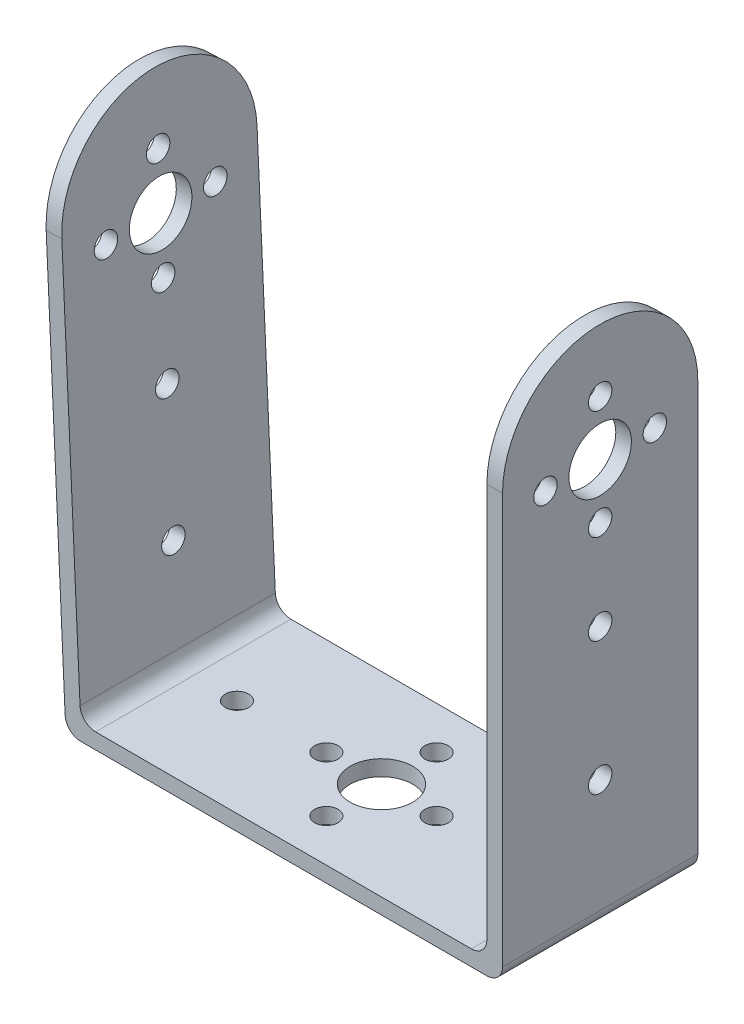
from build123d import *

# Parameters (mm, degrees)
BOSS_EXTRUDE1_DEPTH = 25
SKETCH4_R           = 4
SKETCH4_R_2         = 1.5
CUT_EXTRUDE3_DEPTH  = 2
SKETCH5_R           = 4
SKETCH5_R_2         = 1.5
CUT_EXTRUDE4_DEPTH  = 2
SKETCH6_R           = 4
SKETCH6_R_2         = 1.5
CUT_EXTRUDE5_DEPTH  = 2
FILLET2_R           = 2


with BuildPart() as part:
    # Sketch1 → Boss-Extrude1 (new body)
    with BuildSketch(Plane.XY):
        Polygon((27.999082786, 67), (25.999082786, 67), (25.999082786, 2), (-26.000917214, 2), (-29.000917214, 67), (-30.998790434, 66.907790467), (-27.910738566, 0), (-26.000917214, 0), (27.999082786, 0), align=None)
    extrude(amount=-BOSS_EXTRUDE1_DEPTH)

    # Sketch4 → Cut-Extrude3 (cut)
    with BuildSketch(Plane(origin=(-27.851410119, -1.285449698, 0), x_dir=(0, 0, 1), z_dir=(-0.9989366098486853, -0.046104766608406705, 0))):
        with BuildLine():
            Line((0, 68.265833379), (-12.5, 68.265833379))
            ThreePointArc((-12.5, 68.265833379), (-3.661165235, 64.604668144), (0, 55.765833379))
            Line((0, 55.765833379), (0, 68.265833379))
        make_face()
        with BuildLine():
            Line((-25, 68.265833379), (-25, 55.765833379))
            ThreePointArc((-25, 55.765833379), (-21.338834765, 64.604668144), (-12.5, 68.265833379))
            Line((-12.5, 68.265833379), (-25, 68.265833379))
        make_face()
        with Locations((-12.5, 52.430262694)):
            Circle(SKETCH4_R)
        with Locations((-19.5, 52.430262694)):
            Circle(SKETCH4_R_2)
        with Locations((-12.5, 59.430262694)):
            Circle(SKETCH4_R_2)
        with Locations((-5.5, 52.430262694)):
            Circle(SKETCH4_R_2)
        with Locations((-12.5, 45.430262694)):
            Circle(SKETCH4_R_2)
        with Locations((-12.5, 33.930262694)):
            Circle(SKETCH4_R_2)
        with Locations((-12.5, 16.930262694)):
            Circle(SKETCH4_R_2)
    extrude(amount=-CUT_EXTRUDE3_DEPTH, mode=Mode.SUBTRACT)

    # Sketch5 → Cut-Extrude4 (cut)
    with BuildSketch(Plane(origin=(27.999082786, 0, 0), x_dir=(0, 0, -1), z_dir=(1, 0, 0))):
        with BuildLine():
            Line((25, 67), (12.5, 67))
            ThreePointArc((12.5, 67), (21.338834765, 63.338834765), (25, 54.5))
            Line((25, 54.5), (25, 67))
        make_face()
        with BuildLine():
            Line((0, 67), (0, 54.5))
            ThreePointArc((0, 54.5), (3.661165235, 63.338834765), (12.5, 67))
            Line((12.5, 67), (0, 67))
        make_face()
        with Locations((12.5, 52)):
            Circle(SKETCH5_R)
        with Locations((5.5, 52)):
            Circle(SKETCH5_R_2)
        with Locations((12.5, 59)):
            Circle(SKETCH5_R_2)
        with Locations((19.5, 52)):
            Circle(SKETCH5_R_2)
        with Locations((12.5, 45)):
            Circle(SKETCH5_R_2)
        with Locations((12.5, 33.5)):
            Circle(SKETCH5_R_2)
        with Locations((12.5, 16.5)):
            Circle(SKETCH5_R_2)
    extrude(amount=-CUT_EXTRUDE4_DEPTH, mode=Mode.SUBTRACT)

    # Sketch6 → Cut-Extrude5 (cut)
    with BuildSketch(Plane(origin=(0, 2, 0), x_dir=(1, 0, 0), z_dir=(0, 1, 0))):
        with Locations((-0.000917214, 12.5)):
            Circle(SKETCH6_R)
        with Locations((-7.056810491, 12.5)):
            Circle(SKETCH6_R_2)
        with Locations((-0.000917214, 19.555893276)):
            Circle(SKETCH6_R_2)
        with Locations((7.054976062, 12.5)):
            Circle(SKETCH6_R_2)
        with Locations((-0.000917214, 5.444106724)):
            Circle(SKETCH6_R_2)
        with Locations((18.499082786, 12.5)):
            Circle(SKETCH6_R_2)
        with Locations((-18.500917214, 12.5)):
            Circle(SKETCH6_R_2)
    extrude(amount=-CUT_EXTRUDE5_DEPTH, mode=Mode.SUBTRACT)

    # Fillet2
    fillet2_edges = [part.edges().sort_by_distance(p)[0] for p in [
        (-27.910738566, 0, -12.5),
        (-26.000917214, 2, -12.5),
        (25.999082786, 2, -12.5),
        (27.999082786, 0, -12.5),
    ]]
    fillet(fillet2_edges, radius=FILLET2_R)


solid = part.part
